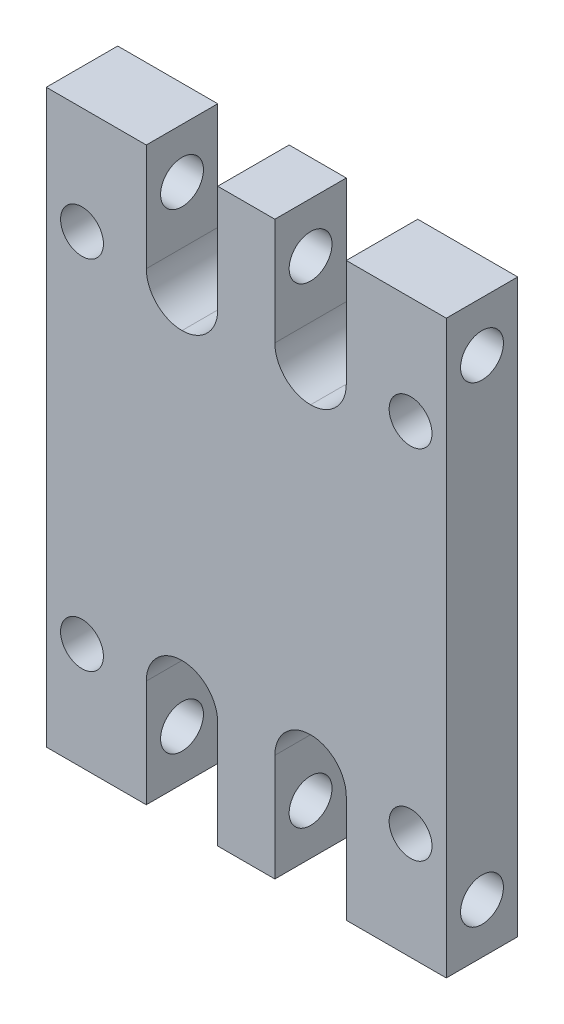
from build123d import *

# Parameters (mm, degrees)
SKETCH_1_R          = 1.5
EXTRUDE_1_DEPTH     = 5
FILLET_1_R          = 2.5
SKETCH_3_R          = 1.5
CUT_EXTRUDE_1_DEPTH = 49


with BuildPart() as part:
    # 草图1 → 凸台-拉伸1 (new body)
    with BuildSketch(Plane.XY):
        Polygon((-14, -20), (-7, -20), (-7, -10), (-2, -10), (-2, -20), (2, -20), (2, -10), (7, -10), (7, -20), (14, -20), (14, 20), (7, 20), (7, 10), (2, 10), (2, 20), (-2, 20), (-2, 10), (-7, 10), (-7, 20), (-14, 20), align=None)
        with Locations((-11.5, 12.5)):
            Circle(SKETCH_1_R, mode=Mode.SUBTRACT)
        with Locations(Location((11.5, 12.5, 0), (0, 0, 180))):
            Circle(SKETCH_1_R, mode=Mode.SUBTRACT)
        with Locations((11.5, -12.5)):
            Circle(SKETCH_1_R, mode=Mode.SUBTRACT)
        with Locations(Location((-11.5, -12.5, 0), (0, 0, 180))):
            Circle(SKETCH_1_R, mode=Mode.SUBTRACT)
    extrude(amount=EXTRUDE_1_DEPTH)

    # 圆角1
    fillet_1_edges = [part.edges().sort_by_distance(p)[0] for p in [
        (7, -10, 2.5),
        (2, -10, 2.5),
        (-2, -10, 2.5),
        (-7, -10, 2.5),
        (7, 10, 2.5),
        (2, 10, 2.5),
        (-2, 10, 2.5),
        (-7, 10, 2.5),
    ]]
    fillet(fillet_1_edges, radius=FILLET_1_R - 0.0001)  # a hair under: the kernel refuses the full size

    # 草图3 → 切除-拉伸1 (cut)
    with BuildSketch(Plane(origin=(14, 0, 0), x_dir=(0, 0, -1), z_dir=(1, 0, 0))):
        with Locations((-2.5, 16.5)):
            Circle(SKETCH_3_R)
        with Locations(Location((-2.5, -16.5, 0), (0, 0, 90))):
            Circle(SKETCH_3_R)
    extrude(amount=-CUT_EXTRUDE_1_DEPTH, mode=Mode.SUBTRACT)


solid = part.part
